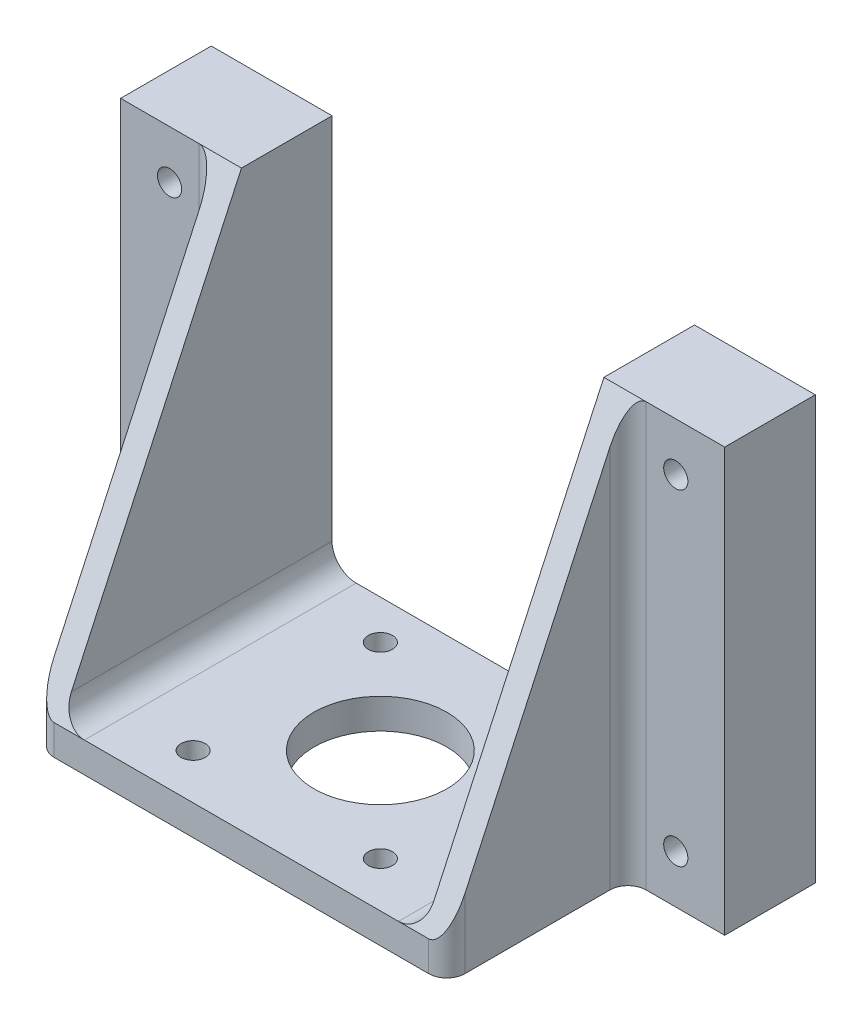
from build123d import *

# Parameters (mm, degrees)
SKETCH_5_W          = 100
SKETCH_5_H          = 70
SKETCH_5_R          = 2
EXTRUDE_10_DEPTH    = 0.0001
SKETCH_6_W          = 60
SKETCH_6_H          = 5
EXTRUDE_11_DEPTH    = 45
SKETCH_7_W          = 4
SKETCH_7_H          = 70
EXTRUDE_12_DEPTH    = 45
CUT_EXTRUDE_1_DEPTH = 76
SKETCH_16_W         = 16
SKETCH_16_H         = 70
EXTRUDE_16_DEPTH    = 15
SKETCH_5_3_R        = 2
CUT_EXTRUDE_2_DEPTH = 49
SKETCH_17_R         = 2
SKETCH_17_R_2       = 11
CUT_EXTRUDE_5_DEPTH = 98.082485547
FILLET_1_R          = 3
SKETCH_18_W         = 60
SKETCH_18_H         = 65
CUT_EXTRUDE_6_DEPTH = 76.828754441
FILLET_2_R          = 4


with BuildPart() as part:
    # 草图5 → 凸台-拉伸10 (new body)
    with BuildSketch(Plane.XY):
        Rectangle(SKETCH_5_W, SKETCH_5_H)
        with Locations((-41.9, 27)):
            Circle(SKETCH_5_R, mode=Mode.SUBTRACT)
        with Locations((-41.9, -27)):
            Circle(SKETCH_5_R, mode=Mode.SUBTRACT)
        with Locations((41.9, -27)):
            Circle(SKETCH_5_R, mode=Mode.SUBTRACT)
        with Locations((41.9, 27)):
            Circle(SKETCH_5_R, mode=Mode.SUBTRACT)
    extrude(amount=EXTRUDE_10_DEPTH)

    # 草图6 → 凸台-拉伸11 (add)
    with BuildSketch(Plane.XY.offset(0.0001)):
        with Locations((0, -32.5)):
            Rectangle(SKETCH_6_W, SKETCH_6_H)
    extrude(amount=EXTRUDE_11_DEPTH)

    # 草图7 → 凸台-拉伸12 (add)
    with BuildSketch(Plane.XY.offset(0.0001)):
        with Locations((-32, 0)):
            Rectangle(SKETCH_7_W, SKETCH_7_H)
        with Locations((32, 0)):
            Rectangle(SKETCH_7_W, SKETCH_7_H)
    extrude(amount=EXTRUDE_12_DEPTH)

    # 草图8 → 切除-拉伸1 (cut)
    with BuildSketch(Plane.ZY.offset(34)):
        Polygon((45.0001, -30), (15.0001, 35), (45.0001, 35), align=None)
    extrude(amount=-CUT_EXTRUDE_1_DEPTH, mode=Mode.SUBTRACT)

    # 草图16 → 凸台-拉伸16 (add)
    with BuildSketch(Plane.XY.offset(0.0001)):
        with Locations((42, 0)):
            Rectangle(SKETCH_16_W, SKETCH_16_H)
        with Locations((-42, 0)):
            Rectangle(SKETCH_16_W, SKETCH_16_H)
    extrude(amount=EXTRUDE_16_DEPTH)

    # 草图5<3> → 切除-拉伸2 (cut)
    with BuildSketch(Plane.XY):
        with Locations((-41.9, 27)):
            Circle(SKETCH_5_3_R)
        with Locations((-41.9, -27)):
            Circle(SKETCH_5_3_R)
        with Locations((41.9, 27)):
            Circle(SKETCH_5_3_R)
        with Locations((41.9, -27)):
            Circle(SKETCH_5_3_R)
    extrude(amount=CUT_EXTRUDE_2_DEPTH, mode=Mode.SUBTRACT)

    # 草图17 → 切除-拉伸5 (cut, through all)
    with BuildSketch(Plane.XZ.offset(35)):
        with Locations((-15.5, 37.5)):
            Circle(SKETCH_17_R)
        with Locations((0, 22)):
            Circle(SKETCH_17_R_2)
        with Locations((15.5, 37.5)):
            Circle(SKETCH_17_R)
        with Locations((-15.5, 6.5)):
            Circle(SKETCH_17_R)
        with Locations((15.5, 6.5)):
            Circle(SKETCH_17_R)
    extrude(amount=-CUT_EXTRUDE_5_DEPTH, mode=Mode.SUBTRACT)

    # 圆角1
    fillet_1_edges = [part.edges().sort_by_distance(p)[0] for p in [
        (34, 0, 15.0001),
        (-34, 0, 15.0001),
        (-34, -32.5, 45.0001),
        (34, -32.5, 45.0001),
    ]]
    fillet(fillet_1_edges, radius=FILLET_1_R)

    # 草图18 → 切除-拉伸6 (cut, through all)
    with BuildSketch(Plane.XY.offset(0.0001)):
        with Locations((0, 2.5)):
            Rectangle(SKETCH_18_W, SKETCH_18_H)
    extrude(amount=-CUT_EXTRUDE_6_DEPTH, mode=Mode.SUBTRACT)

    # 圆角2
    fillet_2_edges = [part.edges().sort_by_distance(p)[0] for p in [
        (-30, -30, 22.50005),
        (30, -30, 22.50005),
    ]]
    fillet(fillet_2_edges, radius=FILLET_2_R)


solid = part.part
